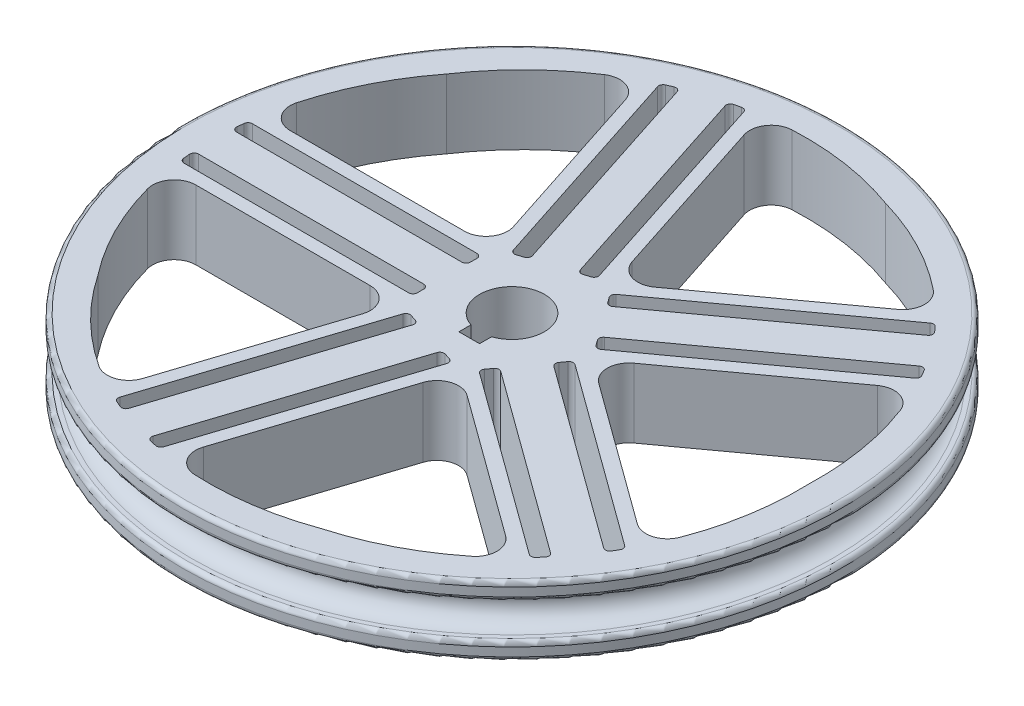
from build123d import *

# Parameters (mm, degrees)
SKETCH2_R          = 7.500000000000012
CUT_EXTRUDE3_DEPTH = 170.35938120812796
SKETCH5_W          = 4.780000000000001
SKETCH5_H          = 3.196434647084515
CUT_EXTRUDE5_DEPTH = 170.35938120812796
CUT_EXTRUDE7_DEPTH = 170.35938120812796
CIRPATTERN1_COUNT  = 5
FILLET1_R          = 5
FILLET2_R          = 5
FILLET3_R          = 1


with BuildPart() as part:
    # Sketch1 → Revolve2 (revolve)
    with BuildSketch(Plane.XY):
        with BuildLine():
            Line((-4.3e-16, 8), (-1.0000000000000004, 8))
            ThreePointArc((-1.0000000000000004, 8), (-1.7071067811865492, 8.292893218813454), (-2.0000000000000004, 9.000000000000002))
            Line((-2.0000000000000004, 9.000000000000002), (-2.0000000000000004, 10.999999999999993))
            ThreePointArc((-2.0000000000000004, 10.999999999999993), (-1.7071067811865483, 11.707106781186548), (-0.9999999999999936, 12))
            Line((-0.9999999999999936, 12), (74.2, 12))
            Line((74.2, 12), (74.2, -4))
            Line((74.2, -4), (-0.9999999999999936, -4))
            ThreePointArc((-0.9999999999999936, -4), (-1.707106781186548, -3.7071067811865475), (-2.0000000000000004, -2.9999999999999933))
            Line((-2.0000000000000004, -2.9999999999999933), (-2.0000000000000004, -1))
            ThreePointArc((-2.0000000000000004, -1), (-1.707106781186548, -0.2928932188134522), (-1.0000000000000002, 2.2e-16))
            Line((-1.0000000000000002, 2.2e-16), (0, 0))
            ThreePointArc((0, 0), (4.000000027037184, 4), (-4.3e-16, 8))
        make_face()
    revolve(axis=Axis((74.2, 12, 0), (0, -1, 0)))

    # Sketch2 → Cut-Extrude3 (cut, through all)
    with BuildSketch(Plane.XZ.offset(4)):
        with Locations((74.2, 0)):
            Circle(SKETCH2_R)
    extrude(amount=-CUT_EXTRUDE3_DEPTH, mode=Mode.SUBTRACT)

    # Sketch5 → Cut-Extrude5 (cut, through all)
    with BuildSketch(Plane.XZ.offset(4)):
        with Locations((74.2, 8.291782676457748)):
            Rectangle(SKETCH5_W, SKETCH5_H)
    extrude(amount=-CUT_EXTRUDE5_DEPTH, mode=Mode.SUBTRACT)

    # Sketch3 → Cut-Extrude7 (cut, symmetric)
    with BuildSketch(Plane.XZ.offset(4)):
        with BuildLine():
            Line((135.9472746622656, 31.391181733176005), (92.74101966249684, 0))
            Line((92.74101966249684, 0), (142.74101966249685, 0))
            ThreePointArc((142.74101966249685, -3.55e-15), (141.29958793690867, 16.118791436038173), (135.94727466226564, 31.39118173317601))
        make_face()
        with BuildLine():
            Line((88.92041552259576, 5.2586104634371535), (90.97766390561942, 2.4270509831248446))
            Line((90.97766390561941, 2.427050983124836), (134.53617144556497, 34.07415916733744))
            ThreePointArc((134.536171445565, 34.074159167337456), (133.66149891930684, 35.599049135257125), (132.74618821640075, 37.09989814818232))
            Line((132.74618821640072, 37.0998981481823), (88.92041552259577, 5.258610463437156))
        make_face()
        with BuildLine():
            Line((95.38033988749895, 65.18638338353188), (79.92949016875157, 17.633557568774194))
            Line((79.92949016875157, 17.633557568774194), (123.13574516852024, 49.024739301950376))
            ThreePointArc((123.13574516852026, 49.02473930195039), (110.26479461810771, 58.83451986559545), (95.38033988749895, 65.18638338353188))
        make_face()
        with BuildLine():
            Line((81.692845925629, 15.206506585649347), (83.75009430865265, 12.374947105337036))
            Line((83.75009430865265, 12.37494710533703), (127.57586700245766, 44.21623479008217))
            ThreePointArc((127.57586700245767, 44.21623479008218), (126.43132133107116, 45.55053484950059), (125.2513534655746, 46.85361476986195))
            Line((125.25135346557457, 46.85361476986195), (81.692845925629, 15.206506585649343))
        make_face()
    cut_extrude7 = extrude(amount=CUT_EXTRUDE7_DEPTH, both=True, mode=Mode.SUBTRACT)

    # CirPattern1: Cut-Extrude7 ×5 about axis
    cirpattern1_axis = Axis((74.2, -4.000000000000344, 0), (-4.63e-15, -1, 0))
    for i in range(1, CIRPATTERN1_COUNT):
        add(cut_extrude7.rotate(cirpattern1_axis, i * 360 / CIRPATTERN1_COUNT), mode=Mode.SUBTRACT)

    # Fillet1
    fillet1_edges = [part.edges().sort_by_distance(p)[0] for p in [
        (79.92949016875163, 4, -17.633557568774187),
        (92.74101966249688, 4, 0),
        (79.92949016875161, 4, 17.633557568774194),
        (59.200000000000045, 3.9999999999999822, 10.89813792008043),
        (59.200000000000045, 3.9999999999999822, -10.898137920080423),
    ]]
    fillet(fillet1_edges, radius=FILLET1_R)

    # Fillet2
    fillet2_edges = [part.edges().sort_by_distance(p)[0] for p in [
        (123.1357451685203, 4, 49.02473930195038),
        (135.94727466226564, 4, 31.391181733176005),
        (135.94727466226556, 3.9999999999999973, -31.391181733176225),
        (123.13574516852013, 4.000000000000003, -49.02473930195053),
        (42.6966791166833, 4.000000000000005, -61.69013691138421),
        (63.42616928543505, 4.00000000000002, -68.42555656007809),
        (5.7941317670957915, 4.000000000000003, -10.898137920080401),
        (5.794131767095848, 4.000000000000005, 10.898137920080622),
        (42.6966791166835, 3.9999999999999742, 61.69013691138436),
        (63.42616928543528, 3.999999999999994, 68.42555656007814),
    ]]
    fillet(fillet2_edges, radius=FILLET2_R)

    # Fillet3
    fillet3_edges = [part.edges().sort_by_distance(p)[0] for p in [
        (134.536171445565, 3.999999999999986, -34.07415916733751),
        (127.57586700245744, 3.9999999999999956, -44.216234790082495),
        (125.2513534655746, 3.999999999999986, -46.853614769862006),
        (132.74618821640058, 4.000000000000004, -37.099898148182675),
        (60.43845123882548, 3.9999999999999876, -67.91260327335033),
        (48.64191177011193, 4.0000000000000195, -64.42703410299885),
        (57.00766722702649, 3.999999999999986, -67.14523282481832),
        (45.41530016784486, 3.9999999999999867, -63.031285590906215),
        (5.028365784003142, 3.9999999999999947, 4.398137920080593),
        (5.358723682190174, 4.000000000000014, -7.89813792008038),
        (5.028365784003114, 3.9999999999999982, -4.398137920080202),
        (5.3587236821902025, 4.000000000000001, 7.89813792008043),
        (60.43845123882554, 4.000000000000002, 67.91260327335034),
        (48.64191177011232, 3.9999999999999956, 64.42703410299903),
        (45.415300167844904, 4, 63.03128559090628),
        (57.007667227026886, 3.9999999999999813, 67.14523282481845),
        (62.05316954888551, 4.000000000000005, 11.825188903205273),
        (73.74762281283313, 3.999999999999985, 15.624947105337043),
        (77.07632061986615, 4.000000000000007, 16.70650658564935),
        (65.38186735591854, 3.999999999999999, 12.90674838351758),
        (59.20000000000006, 3.9999999999999956, 4.3981379200804085),
        (59.200000000000045, 4.0000000000000195, -7.8981379200804085),
        (59.20000000000006, 4.000000000000004, 7.898137920080401),
        (59.200000000000045, 4, -4.398137920080416),
        (77.07632061986615, 3.999999999999993, -16.706506585649343),
        (65.38186735591854, 4.000000000000024, -12.906748383517552),
        (62.05316954888552, 3.999999999999992, -11.825188903205238),
        (73.74762281283313, 3.9999999999999893, -15.624947105337021),
        (83.75009430865269, 3.9999999999999956, -12.374947105337043),
        (90.97766390561947, 3.999999999999986, -2.4270509831248575),
        (81.69284592562903, 3.999999999999986, -15.20650658564935),
        (88.92041552259582, 4.000000000000004, -5.258610463437165),
        (88.9204155225958, 4, 5.258610463437154),
        (90.97766390561945, 4, 2.4270509831248406),
        (134.53617144556503, 4, 34.07415916733745),
        (132.74618821640078, 4, 37.099898148182305),
        (125.25135346557462, 4, 46.85361476986195),
        (127.57586700245771, 4, 44.21623479008218),
        (83.75009430865269, 4, 12.374947105337032),
        (81.69284592562904, 4, 15.206506585649345),
    ]]
    fillet(fillet3_edges, radius=FILLET3_R)


solid = part.part
